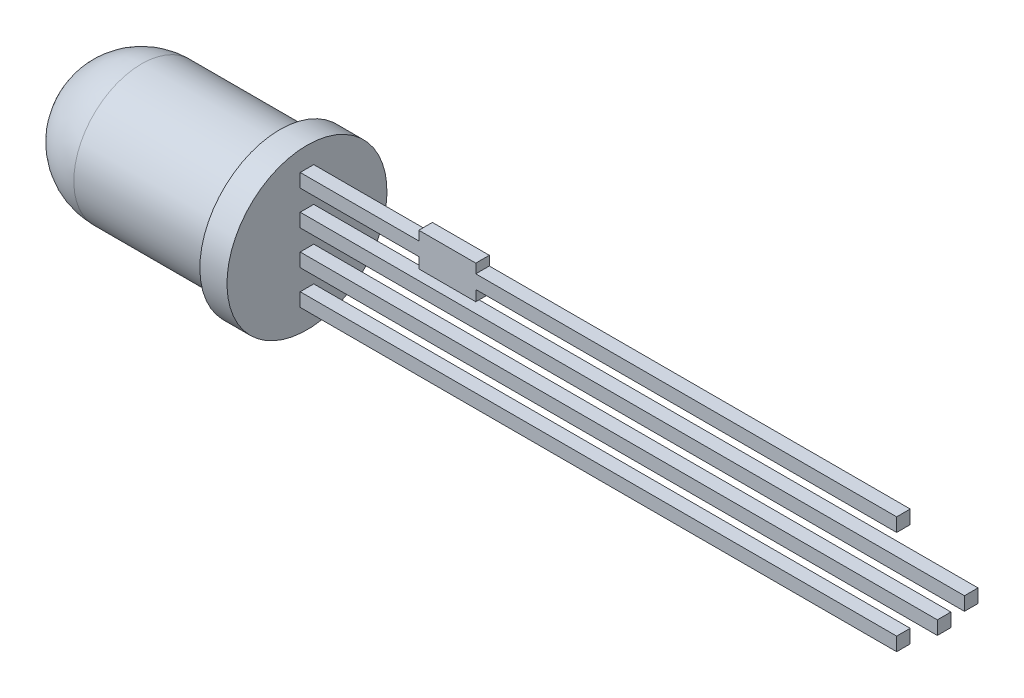
from build123d import *

# Parameters (mm, degrees)
BOSS_EXTRUDE1_DEPTH      = 0.25
BOSS_EXTRUDE1_DEPTH_BACK = 0.25
SKETCH2_W                = 22
SKETCH2_H                = 0.5
SKETCH2_W_2              = 23.5
SKETCH2_W_3              = 24.5


with BuildPart() as part:
    # Sketch1 → Revolve1 (revolve)
    with BuildSketch(Plane.XY):
        with BuildLine():
            Line((-6, 0), (-6, -2.95))
            Line((-6, -2.95), (-7, -2.95))
            Line((-7, -2.95), (-7, -2.5))
            Line((-7, -2.5), (-12.1, -2.5))
            ThreePointArc((-12.1, -2.5), (-13.867766953, -1.767766953), (-14.6, 0))
            Line((-14.6, 0), (-6, 0))
        make_face()
    revolve(axis=Axis((-6, 0, 0), (-1, 0, 0)))

    # Sketch2 → Boss-Extrude1 (add, two sides: drawn at the far end of the back side and taken through both)
    with BuildSketch(Plane.XY.offset(-BOSS_EXTRUDE1_DEPTH_BACK)):
        with Locations((5, -1.855262181)):
            Rectangle(SKETCH2_W, SKETCH2_H)
        with Locations((5.75, -0.585262181)):
            Rectangle(SKETCH2_W_2, SKETCH2_H)
        with Locations((6.25, 0.684737819)):
            Rectangle(SKETCH2_W_3, SKETCH2_H)
        Polygon((-1.623745911, 2.204737819), (-6, 2.204737819), (-6, 1.704737819), (-1.623745911, 1.704737819), (-1.623745911, 1.311776605), (0.47641813, 1.311776605), (0.47641813, 1.704737819), (16, 1.704737819), (16, 2.204737819), (0.47641813, 2.204737819), (0.47641813, 2.547088342), (-1.623745911, 2.547088342), align=None)
    extrude(amount=BOSS_EXTRUDE1_DEPTH + BOSS_EXTRUDE1_DEPTH_BACK)


solid = part.part
